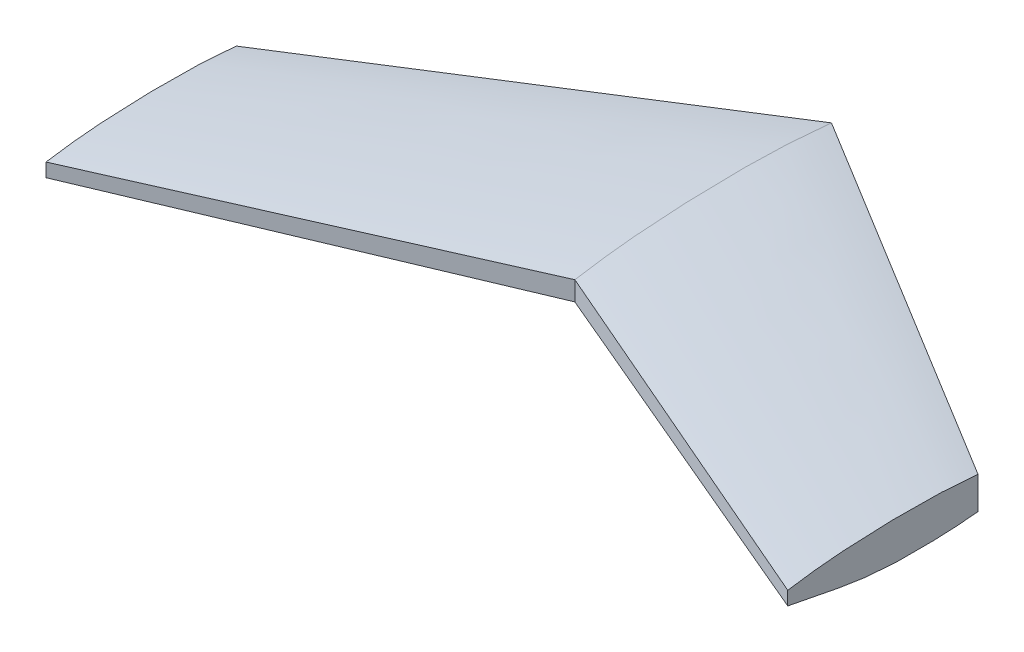
from build123d import *

# Parameters (mm, degrees)
SKETCH4_W          = 217940.907579301
SKETCH4_H          = 93089.135284755
CUT_EXTRUDE1_DEPTH = 10668


with BuildPart() as part:
    # Surface-Knit3: read off the stored shape, not the designer's step
    # Surface-Knit3: loft between two sections, ruled curve by curve
    surface_knit3_from = [
        Edge.make_bspline([(-17711.940475464, -19.490699903, 13543.468166774), (-17711.940475464, -24.803354412, 13505.175719997), (-17711.940475464, -31.396398644, 13464.275981289), (-17711.940475464, -45.430309453, 13381.499157648), (-17711.940475464, -53.344980689, 13336.898353131), (-17711.940475464, -61.065145115, 13290.715817609), (-17711.940475464, -61.767456376, 13286.482697487), (-17711.940475464, -74.289101345, 13210.432056947), (-17711.940475464, -88.890712357, 13108.577006997), (-17711.940475464, -105.610298479, 12959.75813616), (-17711.940475464, -112.428540164, 12883.087596559), (-17711.940475464, -116.055888825, 12834.310114395), (-17711.940475464, -116.205326244, 12832.283421892), (-17711.940475464, -117.058739578, 12820.609367392), (-17711.940475464, -119.658021556, 12783.51276946), (-17711.940475464, -121.828248889, 12746.387473568), (-17711.940475464, -123.322481099, 12716.487057512), (-17711.940475464, -123.44163031, 12714.066644402), (-17711.940475464, -124.475503171, 12692.741231146), (-17711.940475464, -127.196746164, 12629.236726941), (-17711.940475464, -129.548016398, 12535.864319025), (-17711.940475464, -130.304711397, 12439.619928677), (-17711.940475464, -130.109672374, 12364.04802458), (-17711.940475464, -129.476326154, 12305.581144117), (-17711.940475464, -128.678113837, 12256.578612915), (-17711.940475464, -128.009923672, 12223.262795348), (-17711.940475464, -126.248907992, 12147.312787219), (-17711.940475464, -123.889055703, 12075.673268649), (-17711.940475464, -118.082459732, 11956.797831257), (-17711.940475464, -113.908002015, 11893.293757756), (-17711.940475464, -109.171078797, 11837.87389869)], [0, 0, 0, 0, 0.067690989, 0.072531875, 0.147004708, 0.147004708, 0.154518059, 0.154518059, 0.281959224, 0.334640627, 0.416725924, 0.416725924, 0.420284224, 0.420284224, 0.437221308, 0.48539803, 0.48539803, 0.489641218, 0.489641218, 0.522781927, 0.600939606, 0.653181658, 0.691298481, 0.733256996, 0.755561096, 0.77711214, 0.791603663, 0.888581753, 0.90260804, 1, 1, 1, 1], 3),
        Edge.make_bspline([(-17711.940475464, 112.448931944, 11837.87389869), (-17711.940475464, 115.858623311, 11876.338812234), (-17711.940475464, 119.415570244, 11927.264227177), (-17711.940475464, 123.439039127, 12006.164344249), (-17711.940475464, 126.024443681, 12074.694250467), (-17711.940475464, 127.814670989, 12148.130460545), (-17711.940475464, 128.620158562, 12193.612696901), (-17711.940475464, 129.010009381, 12217.930434419), (-17711.940475464, 129.634702387, 12258.081209211), (-17711.940475464, 130.777298991, 12347.600723561), (-17711.940475464, 131.775175378, 12509.868286874), (-17711.940475464, 130.969991963, 12638.99775061), (-17711.940475464, 129.666612166, 12720.880166331), (-17711.940475464, 129.632145327, 12723.011755151), (-17711.940475464, 129.286288491, 12744.069077122), (-17711.940475464, 127.995287538, 12813.148852153), (-17711.940475464, 124.557578721, 12936.558220654), (-17711.940475464, 119.12436106, 13056.338653937), (-17711.940475464, 113.682828529, 13147.513676307), (-17711.940475464, 109.467908518, 13209.729334806), (-17711.940475464, 103.8074791, 13281.534144751), (-17711.940475464, 93.543673458, 13394.159236979), (-17711.940475464, 83.671904107, 13481.322428275), (-17711.940475464, 75.655371215, 13543.468166774)], [0, 0, 0, 0, 0.067814661, 0.089638719, 0.13874429, 0.188246154, 0.218631058, 0.218631058, 0.230957041, 0.28914984, 0.375849943, 0.515921358, 0.515921358, 0.51966521, 0.51966521, 0.552905828, 0.640997482, 0.736461444, 0.763471366, 0.801398092, 0.845969427, 0.889959067, 1, 1, 1, 1], 3),
        Edge.make_line((-17711.940475464, 112.448931944, 11837.87389869), (-17711.940475464, -109.171078797, 11837.87389869)),
        Edge.make_line((-17711.940475464, -19.490699903, 13543.468166774), (-17711.940475464, 75.655371215, 13543.468166774)),
    ]
    surface_knit3_to = [
        Edge.make_bspline([(0, -74.548641103, 5997.694129526), (0, -92.876282917, 5888.310530003), (0, -115.317624049, 5771.595151029), (0, -163.798425653, 5535.659462367), (0, -191.59351315, 5408.710607244), (0, -220.056131458, 5277.429461693), (0, -222.662006122, 5265.398131874), (0, -269.392803808, 5049.276216929), (0, -329.911738534, 4760.387282384), (0, -405.848449007, 4337.516095938), (0, -438.816531993, 4119.141691796), (0, -456.592188962, 3979.949168518), (0, -457.324975774, 3974.165294689), (0, -461.51218458, 3940.846665333), (0, -474.307517862, 3834.929725853), (0, -485.034945558, 3728.772873873), (0, -492.343356759, 3643.196769546), (0, -492.926050751, 3636.268950917), (0, -497.982080071, 3575.226095309), (0, -511.228074838, 3393.340242893), (0, -522.365169387, 3125.569501148), (0, -525.773660709, 2849.468387191), (0, -524.779729774, 2632.675151842), (0, -521.849519313, 2464.95193659), (0, -518.202891169, 2324.394832709), (0, -515.235966946, 2228.843084541), (0, -507.606732796, 2011.025148153), (0, -497.680115772, 1805.623465244), (0, -474.418469864, 1464.962942411), (0, -458.150939984, 1283.101429313), (0, -439.977097141, 1124.567649286)], [0, 0, 0, 0, 0.067690989, 0.072531875, 0.147004708, 0.147004708, 0.154518059, 0.154518059, 0.281959224, 0.334640627, 0.416725924, 0.416725924, 0.420284224, 0.420284224, 0.437221308, 0.48539803, 0.48539803, 0.489641218, 0.489641218, 0.522781927, 0.600939606, 0.653181658, 0.691298481, 0.733256996, 0.755561096, 0.77711214, 0.791603663, 0.888581753, 0.90260804, 1, 1, 1, 1], 3),
        Edge.make_bspline([(0, 434.262669848, 1124.567649286), (0, 446.63171021, 1234.380292573), (0, 460.901570919, 1379.76275731), (0, 479.302580522, 1605.106484751), (0, 492.86883129, 1800.892196295), (0, 504.130561325, 2010.793749301), (0, 509.576661856, 2140.860632533), (0, 512.191507249, 2210.411125812), (0, 516.309968607, 2325.251531297), (0, 523.004020017, 2581.367191943), (0, 526.287976268, 3045.74530127), (0, 518.900370536, 3415.250165612), (0, 511.093601322, 3649.473857333), (0, 510.888200599, 3655.57117725), (0, 508.837793347, 3715.804121181), (0, 501.513216951, 3913.385403224), (0, 484.408696997, 4266.265945864), (0, 460.582530206, 4608.592017012), (0, 438.044605503, 4868.997518035), (0, 420.995286093, 5046.632306258), (0, 398.709430134, 5251.546638341), (0, 359.043008571, 5572.752594931), (0, 321.645333025, 5820.993968722), (0, 291.124383689, 5997.694129526)], [0, 0, 0, 0, 0.067814661, 0.089638719, 0.13874429, 0.188246154, 0.218631058, 0.218631058, 0.230957041, 0.28914984, 0.375849943, 0.515921358, 0.515921358, 0.51966521, 0.51966521, 0.552905828, 0.640997482, 0.736461444, 0.763471366, 0.801398092, 0.845969427, 0.889959067, 1, 1, 1, 1], 3),
        Edge.make_line((0, 434.262669848, 1124.567649286), (0, -439.977097141, 1124.567649286)),
        Edge.make_line((0, -74.548641103, 5997.694129526), (0, 291.124383689, 5997.694129526)),
    ]
    surface_knit3 = Solid(Shell([*[Face.make_surface_from_curves(surface_knit3_from[k], surface_knit3_to[k]) for k in range(4)], Face(Wire(surface_knit3_from)), Face(Wire(surface_knit3_to))]))
    add(surface_knit3)

    # Sketch4 → Cut-Extrude1 (cut)
    with BuildSketch(Plane(origin=(-17711.940475464, 0, 0), x_dir=(0, 0, -1), z_dir=(1, 0, 0))):
        with Locations((-12391.117982578, -2547.446341343)):
            Rectangle(SKETCH4_W, SKETCH4_H)
    extrude(amount=CUT_EXTRUDE1_DEPTH, mode=Mode.SUBTRACT)

    # Mirror1: part across plane


with BuildPart() as part_1:
    add(part.part)
    add(part.part.mirror(Plane(origin=(0, 0, 0), x_dir=(0, 0, 1), z_dir=(1, 0, 0))))


solid = part_1.part
